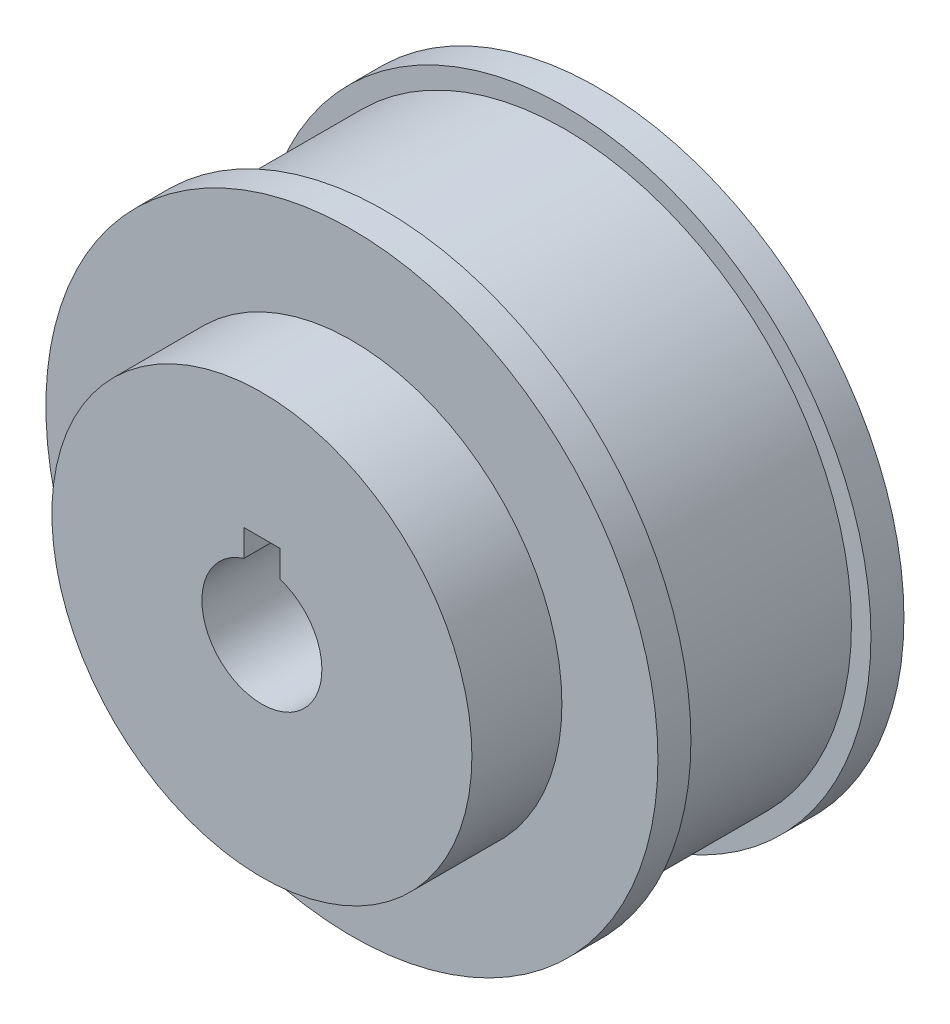
from build123d import *

# Parameters (mm, degrees)
SZKIC1_R                    = 23.875
DODANIE_WYCI_GNI_CIE1_DEPTH = 20.5
SZKIC2_R                    = 17.5
DODANIE_WYCI_GNI_CIE2_DEPTH = 7.5
SZKIC3_R                    = 25.5
DODANIE_WYCI_GNI_CIE3_DEPTH = 2.75
SZYK_LINIOWY1_COUNT         = 2
SZYK_LINIOWY1_PITCH         = 17.75
SZKIC5_R                    = 5
WYTNIJ_WYCI_GNI_CIE2_DEPTH  = 30
SZKIC6_W                    = 3
SZKIC6_H                    = 7
WYTNIJ_WYCI_GNI_CIE3_DEPTH  = 40


with BuildPart() as part:
    # Szkic1 → Dodanie-wyciągnięcie1 (new body)
    with BuildSketch(Plane.XY):
        Circle(SZKIC1_R)
    extrude(amount=DODANIE_WYCI_GNI_CIE1_DEPTH)

    # Szkic2 → Dodanie-wyciągnięcie2 (add)
    with BuildSketch(Plane.XY.offset(20.5)):
        Circle(SZKIC2_R)
    extrude(amount=DODANIE_WYCI_GNI_CIE2_DEPTH)

    # Szkic3 → Dodanie-wyciągnięcie3 (add)
    with BuildSketch(Plane.XY.offset(20.5)):
        Circle(SZKIC3_R)
    dodanie_wyci_gni_cie3 = extrude(amount=-DODANIE_WYCI_GNI_CIE3_DEPTH)

    # Szyk liniowy1: Dodanie-wyciągnięcie3 ×2
    with Locations(*[(0, 0, -i * SZYK_LINIOWY1_PITCH) for i in range(1, SZYK_LINIOWY1_COUNT)]):
        add(dodanie_wyci_gni_cie3)

    # Szkic5 → Wytnij-wyciągnięcie2 (cut)
    with BuildSketch(Plane.XY.offset(28)):
        Circle(SZKIC5_R)
    extrude(amount=-WYTNIJ_WYCI_GNI_CIE2_DEPTH, mode=Mode.SUBTRACT)

    # Szkic6 → Wytnij-wyciągnięcie3 (cut)
    with BuildSketch(Plane.XY.offset(28)):
        with Locations((0, 3.5)):
            Rectangle(SZKIC6_W, SZKIC6_H)
    extrude(amount=-WYTNIJ_WYCI_GNI_CIE3_DEPTH, mode=Mode.SUBTRACT)


solid = part.part
